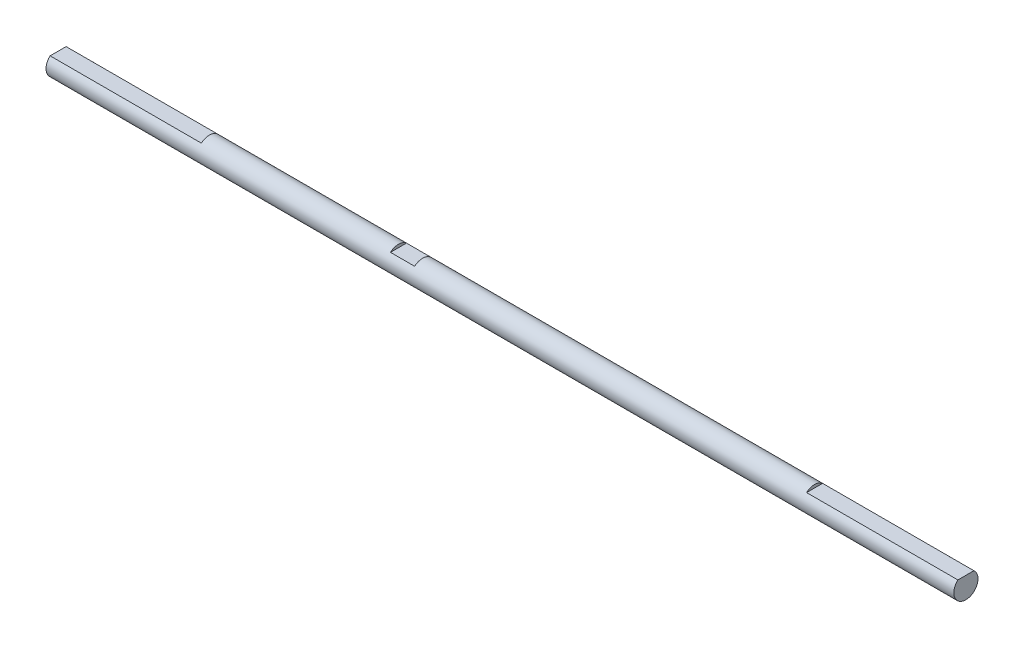
from build123d import *

# Parameters (mm, degrees)
BOSS_EXTRUDE1_DEPTH     = 75
SKETCH2_R               = 2
BOSS_EXTRUDE2_DEPTH     = 50
CUT_EXTRUDE1_DEPTH      = 76.053314384
CUT_EXTRUDE1_DEPTH_BACK = 76.053314384
SKETCH3_W               = 4
SKETCH3_H               = 0.5


with BuildPart() as part:
    # Sketch1 → Boss-Extrude1 (new, symmetric)
    with BuildSketch(Plane(origin=(0, 0, 0), x_dir=(0, 0, -1), z_dir=(1, 0, 0))):
        with BuildLine():
            Line((-1.322875656, 1.5), (1.322875656, 1.5))
            ThreePointArc((1.322875656, 1.5), (0, -2), (-1.322875656, 1.5))
        make_face()
    extrude(amount=BOSS_EXTRUDE1_DEPTH, both=True)

    # Sketch2 → Boss-Extrude2 (add, symmetric)
    with BuildSketch(Plane(origin=(0, 0, 0), x_dir=(0, 0, -1), z_dir=(1, 0, 0))):
        Circle(SKETCH2_R)
    extrude(amount=BOSS_EXTRUDE2_DEPTH, both=True)

    # Sketch3 → Cut-Extrude1 (cut, two sides: drawn at the far end of the back side and taken through both)
    with BuildSketch(Plane.XY.offset(-CUT_EXTRUDE1_DEPTH_BACK)):
        with Locations((-16.76, 1.75)):
            Rectangle(SKETCH3_W, SKETCH3_H)
    extrude(amount=CUT_EXTRUDE1_DEPTH + CUT_EXTRUDE1_DEPTH_BACK, mode=Mode.SUBTRACT)


solid = part.part
